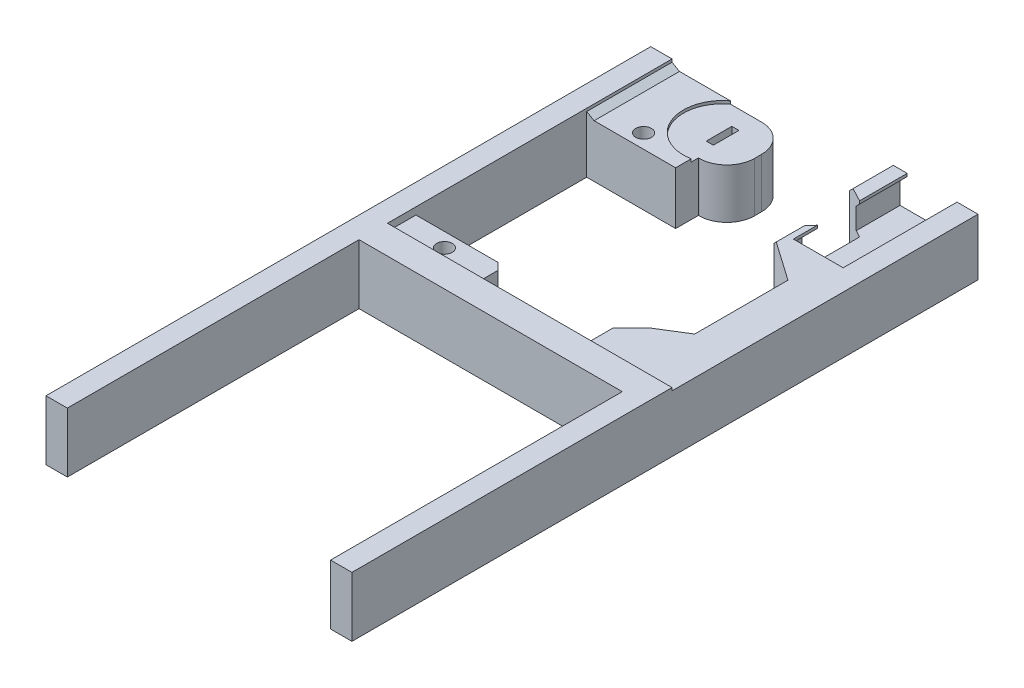
from build123d import *
from OCP.BRepFilletAPI import BRepFilletAPI_MakeChamfer

# Parameters (mm, degrees)
SKETCH1_W                       = 3
SKETCH1_H                       = 37
SKETCH1_H_2                     = 48
BOSS_EXTRUDE1_DEPTH             = 8
SKETCH4_W                       = 19.5
SKETCH4_H                       = 8.8
BOSS_EXTRUDE3_DEPTH             = 6.6
SERVO_HOLDER_DEPTH              = 0.4
SERVO_HOLDER_DEPTH_BACK         = 7
SKETCH3_W                       = 15.5
SKETCH3_H                       = 4
SKETCH3_R                       = 1.04
SKETCH5_W                       = 1
SKETCH5_H                       = 3.6
CUT_EXTRUDE2_DEPTH              = 70.647801738
SKETCH11_W                      = 43
SKETCH11_H                      = 4
BOSS_EXTRUDE9_DEPTH             = 8
BOSS_EXTRUDE9_DIRECTION_2_REACH = 71.601
SKETCH14_W                      = 12.223643904
SKETCH14_H                      = 44.979564252
CUT_EXTRUDE5_DEPTH              = 10
FILLET2_R                       = 3.9
CUT_EXTRUDE4_DEPTH              = 70.647801738
CUT_EXTRUDE4_DEPTH_BACK         = 70.647801738
SKETCH13_R                      = 1.1
SKETCH17_W                      = 12.9
SKETCH17_H                      = 8
BOSS_EXTRUDE11_DEPTH            = 27
BOSS_EXTRUDE12_DEPTH            = 16
SKETCH18_W                      = 1
SKETCH18_H                      = 3.6
SKETCH18_W_2                    = 3
SKETCH18_H_2                    = 24
SKETCH18_H_3                    = 41
BOSS_EXTRUDE13_DEPTH            = 0.4
CHAMFER14_SIZE                  = 1.2
CUT_EXTRUDE6_DEPTH              = 73.439806169
CUT_EXTRUDE6_DEPTH_BACK         = 73.439806169
SKETCH29_W                      = 8.885937164
SKETCH29_H                      = 8
BOSS_EXTRUDE20_DEPTH            = 0.4
CHAMFER23_SIZE                  = 1
CHAMFER24_SIZE                  = 1
CHAMFER24_SIZE2                 = 3.099667104
SKETCH26_R                      = 5.5
CUT_EXTRUDE8_DEPTH              = 10
CHAMFER25_SIZE                  = 0.6
CHAMFER25_SIZE2                 = 1.039230485


with BuildPart() as part:
    # Sketch1 → Boss-Extrude1 (new body)
    with BuildSketch(Plane(origin=(0, 0, 0), x_dir=(1, 0, 0), z_dir=(0, 1, 0))):
        with Locations((-20, -0.788461538)):
            Rectangle(SKETCH1_W, SKETCH1_H)
        with Locations((-20, 41.711538462)):
            Rectangle(SKETCH1_W, SKETCH1_H_2)
        with Locations((20, -0.788461538)):
            Rectangle(SKETCH1_W, SKETCH1_H)
        with Locations((20, 41.711538462)):
            Rectangle(SKETCH1_W, SKETCH1_H_2)
    extrude(amount=-BOSS_EXTRUDE1_DEPTH)

    # Sketch4 → Boss-Extrude3 (add)
    with BuildSketch(Plane.XZ.offset(8)):
        with Locations((-11.75, -61.311538462)):
            Rectangle(SKETCH4_W, SKETCH4_H)
    extrude(amount=-BOSS_EXTRUDE3_DEPTH)

    # Sketch3 → Servo Holder (add, two sides: drawn at the far end of the back side and taken through both)
    # profile 1 of 2: a face of its own
    with BuildSketch(Plane.XZ.offset(8).offset(-SERVO_HOLDER_DEPTH_BACK)):
        with Locations((-13.75, -55.711538462)):
            Rectangle(SKETCH3_W, SKETCH3_H)
        with Locations(Location((-12.5, -55.711538462, 0), (0, 0, 270))):
            Circle(SKETCH3_R, mode=Mode.SUBTRACT)
    # profile 2 of 2: a face of its own
    with BuildSketch(Plane.XZ.offset(8).offset(-SERVO_HOLDER_DEPTH_BACK)):
        with Locations((-13.75, -27.711538462)):
            Rectangle(SKETCH3_W, SKETCH3_H)
        with Locations(Location((-12.5, -27.711538462, 0), (0, 0, 90))):
            Circle(SKETCH3_R, mode=Mode.SUBTRACT)
    extrude(amount=SERVO_HOLDER_DEPTH + SERVO_HOLDER_DEPTH_BACK)

    # Sketch5 → Cut-Extrude2 (cut, through all)
    with BuildSketch(Plane(origin=(0, 0, 0), x_dir=(1, 0, 0), z_dir=(0, 1, 0))):
        with Locations((-7, 61.311538462)):
            Rectangle(SKETCH5_W, SKETCH5_H)
    extrude(amount=-CUT_EXTRUDE2_DEPTH, mode=Mode.SUBTRACT)

    # Sketch11 → Boss-Extrude9 (add)
    with BuildSketch(Plane.XZ.offset(8)):
        with Locations((0, -23.711538462)):
            Rectangle(SKETCH11_W, SKETCH11_H)
    extrude(amount=-BOSS_EXTRUDE9_DEPTH)

    # Boss-Extrude9 direction 2: up to this face of the body (flat: up to its plane)
    boss_extrude9_direction_2_end = Plane(part.part.faces().sort_by_distance((-13.822479257, -8.4, -55.711538462))[0])
    # Sketch11 → Boss-Extrude9 direction 2 (add, up to the picked face)
    with BuildSketch(Plane.XZ.offset(8), mode=Mode.PRIVATE) as boss_extrude9_direction_2_sk1:
        with Locations((0, -23.711538462)):
            Rectangle(SKETCH11_W, SKETCH11_H)
    boss_extrude9_direction_2_tool1 = split(extrude(boss_extrude9_direction_2_sk1.sketch, amount=BOSS_EXTRUDE9_DIRECTION_2_REACH, mode=Mode.PRIVATE), bisect_by=boss_extrude9_direction_2_end, keep=Keep.BOTH, mode=Mode.PRIVATE)
    add(boss_extrude9_direction_2_tool1.solids().sort_by(Axis((0, -8, -23.711538), (0, -1, 0)))[0])

    # Sketch14 → Cut-Extrude5 (cut)
    with BuildSketch(Plane.XZ.offset(8)):
        with Locations((24.611821952, -48.201320588)):
            Rectangle(SKETCH14_W, SKETCH14_H)
    extrude(amount=-CUT_EXTRUDE5_DEPTH, mode=Mode.SUBTRACT)

    # Fillet2
    fillet2_edges = [part.edges().sort_by_distance(p)[0] for p in [
        (-2, -4.7, -65.711538462),
        (-2, -4.7, -56.911538462),
    ]]
    fillet(fillet2_edges, radius=FILLET2_R)

    # Sketch13 → Cut-Extrude4 (cut, two sides: drawn at the far end of the back side and taken through both)
    with BuildSketch(Plane(origin=(0, -8.4, 0), x_dir=(-1, 0, 0), z_dir=(0, -1, 0)).offset(-CUT_EXTRUDE4_DEPTH_BACK)):
        with Locations(Location((12.5, 55.711538462, 0), (0, 0, 270))):
            Circle(SKETCH13_R)
        with Locations(Location((12.5, 27.711538462, 0), (0, 0, 270))):
            Circle(SKETCH13_R)
    extrude(amount=CUT_EXTRUDE4_DEPTH + CUT_EXTRUDE4_DEPTH_BACK, mode=Mode.SUBTRACT)

    # Sketch17 → Boss-Extrude11 (add)
    with BuildSketch(Plane(origin=(0, 0, -25.711538462), x_dir=(-1, 0, 0), z_dir=(0, 0, -1))):
        with Locations((-15.05, -4.4)):
            Rectangle(SKETCH17_W, SKETCH17_H)
    extrude(amount=BOSS_EXTRUDE11_DEPTH)

    # Sketch16 → Boss-Extrude12 (add)
    with BuildSketch(Plane(origin=(0, 0, -52.711538462), x_dir=(-1, 0, 0), z_dir=(0, 0, -1))):
        Polygon((-19.75, -2), (-18.55, -2), (-18.55, -0.4), (-21.5, -0.4), (-21.5, -8.4), (-8.6, -8.4), (-8.6, -0.4), (-11.55, -0.4), (-11.55, -2), (-10.55, -2), (-10.55, -4.8), (-19.75, -4.8), align=None)
    extrude(amount=BOSS_EXTRUDE12_DEPTH)

    # Sketch18 → Boss-Extrude13 (add)
    # profile 1 of 4: a face of its own
    with BuildSketch(Plane.XZ.offset(8)):
        with BuildLine():
            Line((-21.5, -57.711538462), (-21.5, -65.711538462))
            Line((-21.5, -65.711538462), (-5.9, -65.711538462))
            ThreePointArc((-5.9, -65.711538462), (-3.142283553, -64.569254908), (-2, -61.811538462))
            Line((-2, -61.811538462), (-2, -60.811538462))
            ThreePointArc((-2, -60.811538462), (-3.142283553, -58.053822015), (-5.9, -56.911538462))
            Line((-5.9, -56.911538462), (-6, -56.911538462))
            Line((-6, -56.911538462), (-6, -57.711538462))
            Line((-6, -57.711538462), (-21.5, -57.711538462))
        make_face()
        with Locations((-7, -61.311538462)):
            Rectangle(SKETCH18_W, SKETCH18_H, mode=Mode.SUBTRACT)
    # profile 2 of 4: a face of its own
    with BuildSketch(Plane.XZ.offset(8)):
        with Locations((-20, -41.711538462)):
            Rectangle(SKETCH18_W_2, SKETCH18_H_2)
    # profile 3 of 4: a face of its own
    with BuildSketch(Plane.XZ.offset(8)):
        with Locations((-20, -1.211538462)):
            Rectangle(SKETCH18_W_2, SKETCH18_H_3)
    # profile 4 of 4: a face of its own
    with BuildSketch(Plane.XZ.offset(8)):
        with Locations((20, -1.211538462)):
            Rectangle(SKETCH18_W_2, SKETCH18_H_3)
    extrude(amount=BOSS_EXTRUDE13_DEPTH)

    # Chamfer14
    # the kernel refuses this chamfer: 1.2 mm, written as the material it takes off along each edge
    with BuildSketch(Plane(origin=(18.55, -2, -52.711538462), x_dir=(0.9996219169112968, -0.027495876610586622, 0), z_dir=(0, 0, -1))) as chamfer14_piece_1_section:
        Polygon((CHAMFER14_SIZE * 0.999621916911, -CHAMFER14_SIZE * 0.0274958766106), (-CHAMFER14_SIZE * 0.0274958766106, -CHAMFER14_SIZE * 0.999621916911), (0, 0), align=None)
    chamfer14_piece_1 = extrude(amount=19.086019586, mode=Mode.PRIVATE)
    chamfer14_piece_1 = split(chamfer14_piece_1, bisect_by=Plane(origin=(19.75, -1.603515015, -62.254548254), z_dir=(-1, 0, 0)), keep=Keep.TOP, mode=Mode.PRIVATE)
    add(chamfer14_piece_1, mode=Mode.SUBTRACT)
    with BuildSketch(Plane(origin=(11.55, -2, -52.711538462), x_dir=(0.027495876610585914, 0.9996219169112968, 0), z_dir=(0, 0, -1))) as chamfer14_piece_2_section:
        Polygon((CHAMFER14_SIZE * 0.999621916911, -CHAMFER14_SIZE * 0.0274958766106), (-CHAMFER14_SIZE * 0.0274958766106, -CHAMFER14_SIZE * 0.999621916911), (0, 0), align=None)
    chamfer14_piece_2 = extrude(amount=19.086019586, mode=Mode.PRIVATE)
    chamfer14_piece_2 = split(chamfer14_piece_2, bisect_by=Plane(origin=(10.55, -1.589568171, -62.254548254), z_dir=(1, 0, 0)), keep=Keep.TOP, mode=Mode.PRIVATE)
    add(chamfer14_piece_2, mode=Mode.SUBTRACT)

    # Sketch20 → Cut-Extrude6 (cut, two sides: drawn at the far end of the back side and taken through both)
    with BuildSketch(Plane(origin=(0, -0.4, 0), x_dir=(1, 0, 0), z_dir=(0, 1, 0)).offset(-CUT_EXTRUDE6_DEPTH_BACK)):
        Polygon((8.6, 53.963605621), (8.6, 63.570761525), (2.515498959, 66.765310983), (1.997773223, 58.659131413), (1.997773223, 53.963605621), (4.974693998, 53.963605621), (4.974693998, 55.162371456), (6.687222193, 53.963605621), align=None)
        Polygon((8.6, 52.700948092), (8.6, 53.963605621), (6.687222193, 53.963605621), (8.558718605, 52.653562397), align=None)
        Polygon((16.174786864, 47.322331969), (9.7, 51.854668021), (9.7, 30.195176122), (16.174786864, 34.211808124), align=None)
        Polygon((4.974693998, 53.963605621), (6.687222193, 53.963605621), (4.974693998, 55.162371456), align=None)
        Polygon((11.55, 56.087166011), (11.55, 62.021921145), (8.6, 63.570761525), (8.6, 53.963605621), (9.7, 53.963605621), align=None)
        Polygon((8.6, 52.624665515), (8.6, 52.700948092), (8.558718605, 52.653562397), align=None)
        Polygon((9.7, 25.711538462), (9.7, 30.195176122), (8.6, 29.512791467), (8.6, 25.711538462), align=None)
        Polygon((9.7, 53.963605621), (8.6, 53.963605621), (8.6, 52.700948092), align=None)
        Polygon((9.7, 51.854668021), (9.7, 53.963605621), (8.6, 52.700948092), (8.6, 52.624665515), align=None)
        Polygon((8.558718605, 52.653562397), (6.687222193, 53.963605621), (4.974693998, 53.963605621), (4.974693998, 48.539566347), align=None)
        Polygon((9.7, 30.195176122), (9.7, 51.854668021), (8.6, 52.624665515), (8.6, 29.512791467), align=None)
        Polygon((8.6, 52.624665515), (8.558718605, 52.653562397), (4.974693998, 48.539566347), (4.974693998, 27.263834025), (8.6, 29.512791467), align=None)
    extrude(amount=CUT_EXTRUDE6_DEPTH + CUT_EXTRUDE6_DEPTH_BACK, mode=Mode.SUBTRACT)

    # Sketch29 → Boss-Extrude20 (add)
    with BuildSketch(Plane(origin=(0, -1.4, 0), x_dir=(1, 0, 0), z_dir=(0, 1, 0))):
        with Locations((-14.057031418, 61.711538462)):
            Rectangle(SKETCH29_W, SKETCH29_H)
    extrude(amount=BOSS_EXTRUDE20_DEPTH)

    # Chamfer23
    chamfer23_edges = [part.edges().sort_by_distance(p)[0] for p in [
        (9.7, -0.4, -52.909136821),
    ]]
    chamfer(chamfer23_edges, length=CHAMFER23_SIZE)

    # Chamfer24: one chamfer whose edges measure the first distance from different faces: ONE call of the kernel's chamfer builder (chamfer() names one face for all edges)
    chamfer24_edges_1 = [part.edges().sort_by_distance(p)[0] for p in [
        (8.6, -0.4, -66.141149993),
        (-6, -4.7, -29.711538462),
    ]]
    chamfer24_edges_2 = [part.edges().sort_by_distance(p)[0] for p in [
        (9.7, -4.4, -30.195176122),
    ]]
    chamfer24_side_2 = [part.faces().sort_by_distance(p)[0] for p in [
        (9.7, -4.4, -27.953357292),
    ]]
    chamfer24 = BRepFilletAPI_MakeChamfer(part.part.solid().wrapped)
    for e in chamfer24_edges_1:
        chamfer24.Add(CHAMFER24_SIZE, e.wrapped)
    for e in chamfer24_edges_2:
        chamfer24.Add(CHAMFER24_SIZE, CHAMFER24_SIZE2, e.wrapped, chamfer24_side_2[0].wrapped)  # the first distance lies on this face
    add(Compound.cast(chamfer24.Shape()), mode=Mode.REPLACE)

    # Sketch26 → Cut-Extrude8 (cut)
    with BuildSketch(Plane(origin=(0, -1.4, 0), x_dir=(1, 0, 0), z_dir=(0, 1, 0))):
        with Locations((-7, 61.311538462)):
            Circle(SKETCH26_R)
    extrude(amount=CUT_EXTRUDE8_DEPTH, mode=Mode.SUBTRACT)

    # Chamfer25
    chamfer25_edges = [part.edges().sort_by_distance(p)[0] for p in [
        (-18.5, -1, -59.711538462),
    ]]
    chamfer25_side = [part.faces().sort_by_distance(p)[0] for p in [
        (-18.5, -3.927941176, -42.446832579),
    ]]
    chamfer(chamfer25_edges, length=CHAMFER25_SIZE, length2=CHAMFER25_SIZE2, reference=chamfer25_side[0])


solid = part.part
